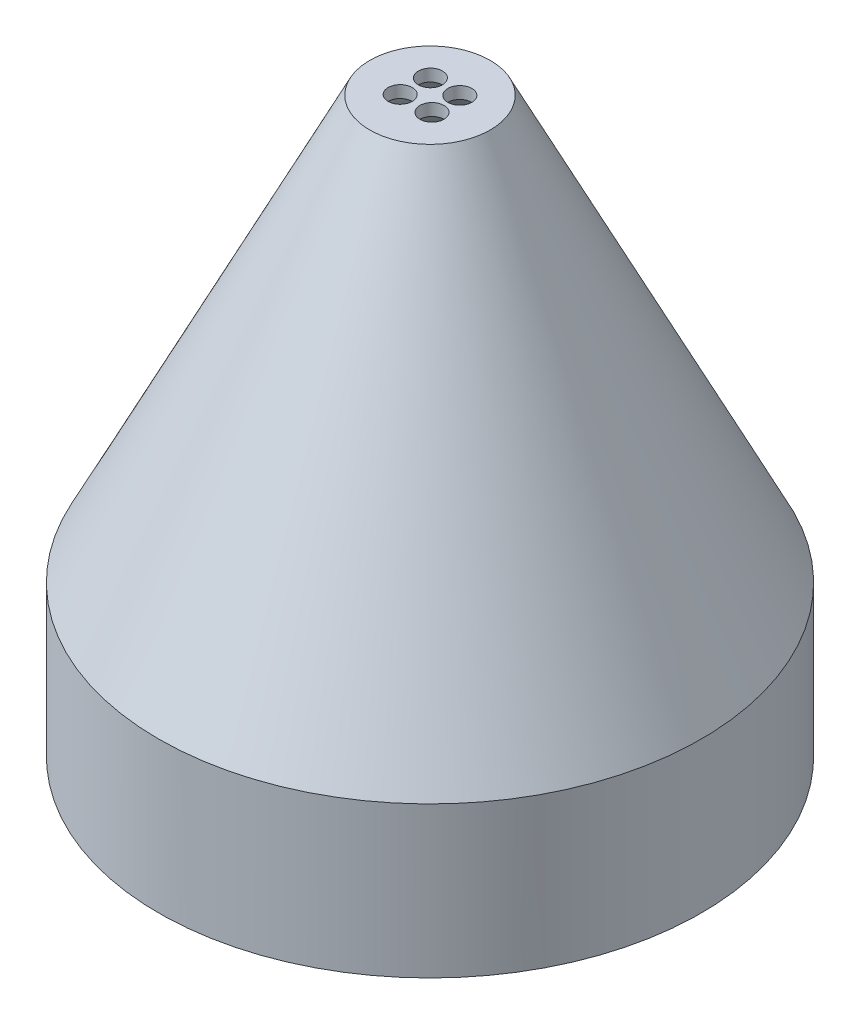
from build123d import *

# Parameters (mm, degrees)
SKETCH_1_R          = 45
SKETCH_1_R_2        = 43.5
EXTRUDE_1_DEPTH     = 25
EXTRUDE_2_DEPTH     = 3
SKETCH_6_R          = 2
CUT_EXTRUDE_1_DEPTH = 3


# Read off the part's stored shape, not the designer's step: 抽壳9
with BuildPart() as part:
    # 草图1 → 凸台-拉伸1 (new body)
    with BuildSketch(Plane(origin=(0, 0, 0), x_dir=(1, 0, 0), z_dir=(0, 1, 0))):
        with Locations(Location((0, 0, 0), (0, 0, 270))):
            Circle(SKETCH_1_R)
        with Locations(Location((0, 0, 0), (0, 0, 270))):
            Circle(SKETCH_1_R_2, mode=Mode.SUBTRACT)
    extrude(amount=EXTRUDE_1_DEPTH)

    # 草图2 → 凸台-拉伸2 (add)
    with BuildSketch(Plane(origin=(0, 0, 0), x_dir=(1, 0, 0), z_dir=(0, 1, 0))):
        with BuildLine():
            Line((-45, 0), (-53, 0))
            ThreePointArc((-53, 0), (-45.144679687, 31.028280094), (-18.991709994, 49.480445253))
            Line((-18.991709994, 49.480445253), (-16.117646372, 42.014538858))
            ThreePointArc((-16.117646372, 42.014538858), (-37.082975115, 25.492213647), (-45, 0))
        make_face()
    extrude(amount=EXTRUDE_2_DEPTH)

    # 草图5 → 旋转3 (revolve)
    with BuildSketch(Plane.XY, mode=Mode.PRIVATE) as revolve_3_sk:
        Polygon((-45, 25), (0, 25), (0, 95), (-10, 95), align=None)
    revolve(revolve_3_sk.sketch.rotate(Axis((0, 25, 0), (0, 1, 0)), 270), axis=Axis((0, 25, 0), (0, 1, 0)))

    # 抽壳9 outline → 抽壳9 (revolve, cut)
    with BuildSketch(Plane.XY):
        Polygon((42.763932023, 25), (8.763932023, 93), (0, 93), (0, 25), align=None)
    revolve(axis=Axis((0, 0, 0), (0, 1, 0)), mode=Mode.SUBTRACT)

    # 草图6 → 切除-拉伸1 (cut)
    with BuildSketch(Plane.XZ.offset(-93)):
        with Locations(Location((-2.574448684, 2.371120826, 0), (0, 0, 270))):
            Circle(SKETCH_6_R)
        with Locations(Location((2.6320911, 2.306966935, 0), (0, 0, 270))):
            Circle(SKETCH_6_R)
        with Locations(Location((-2.443496184, -2.505858416, 0), (0, 0, 270))):
            Circle(SKETCH_6_R)
        with Locations(Location((2.504843697, -2.444536368, 0), (0, 0, 270))):
            Circle(SKETCH_6_R)
    extrude(amount=-CUT_EXTRUDE_1_DEPTH, mode=Mode.SUBTRACT)


solid = part.part
